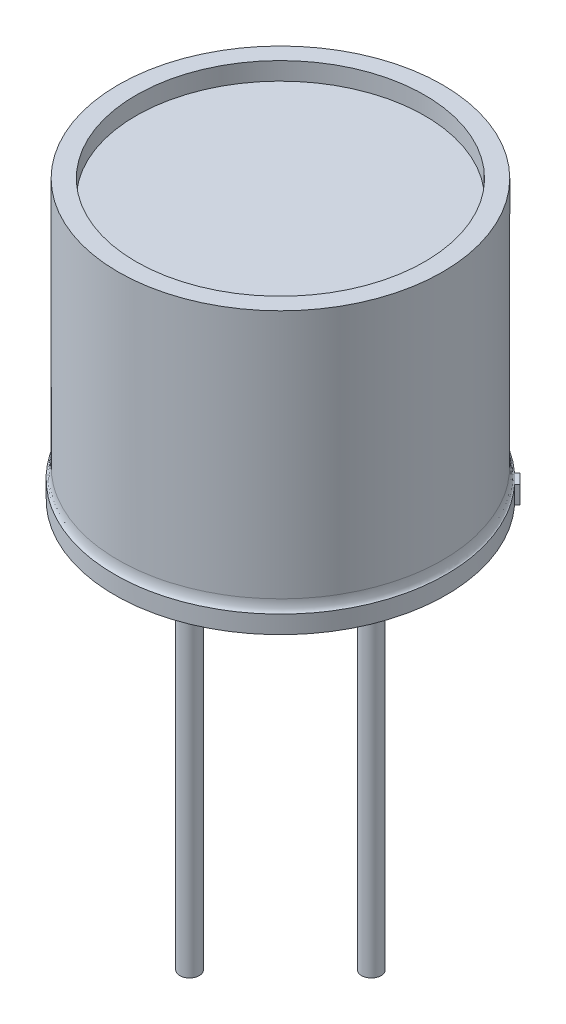
from build123d import *

# Parameters (mm, degrees)
SKETCH1_R           = 4.55
BOSS_EXTRUDE1_DEPTH = 7.8
SKETCH2_R           = 4.050000028
CUT_EXTRUDE1_DEPTH  = 0.5
SKETCH3_R           = 0.275
BOSS_EXTRUDE2_DEPTH = 10.16
SKETCH4_R           = 4.65
BOSS_EXTRUDE3_DEPTH = 0.5
FILLET1_SIZE        = 0.1
FILLET1_SIZE_2      = 0.3
BOSS_EXTRUDE4_DEPTH = 0.5


with BuildPart() as part:
    # Sketch1 → Boss-Extrude1 (new body)
    with BuildSketch(Plane(origin=(0, 0, 0), x_dir=(1, 0, 0), z_dir=(0, 1, 0))):
        with Locations(Location((0, 0, 0), (0, 0, 270))):
            Circle(SKETCH1_R)
    extrude(amount=BOSS_EXTRUDE1_DEPTH)

    # Sketch2 → Cut-Extrude1 (cut)
    with BuildSketch(Plane(origin=(0, 7.8, 0), x_dir=(1, 0, 0), z_dir=(0, 1, 0))):
        with Locations(Location((0, 0, 0), (0, 0, 270))):
            Circle(SKETCH2_R)
    extrude(amount=-CUT_EXTRUDE1_DEPTH, mode=Mode.SUBTRACT)

    # Sketch3 → Boss-Extrude2 (add)
    with BuildSketch(Plane(origin=(0, 0, 0), x_dir=(-1, 0, 0), z_dir=(0, -1, 0))):
        with Locations(Location((0, 2.55, 0), (0, 0, 270))):
            Circle(SKETCH3_R)
        with Locations(Location((2.55, 0, 0), (0, 0, 270))):
            Circle(SKETCH3_R)
        with Locations(Location((0, -2.55, 0), (0, 0, 270))):
            Circle(SKETCH3_R)
        with Locations(Location((-2.55, 0, 0), (0, 0, 270))):
            Circle(SKETCH3_R)
    extrude(amount=BOSS_EXTRUDE2_DEPTH)

    # Sketch4 → Boss-Extrude3 (add)
    with BuildSketch(Plane(origin=(0, 0, 0), x_dir=(-1, 0, 0), z_dir=(0, -1, 0))):
        with Locations(Location((0, 0, 0), (0, 0, 90))):
            Circle(SKETCH4_R)
    extrude(amount=-BOSS_EXTRUDE3_DEPTH)

    # Fillet1
    # an asymmetric fillet: 0.3, 0.1 mm, written as the material it adds along each edge
    with BuildSketch(Plane(origin=(0, 0.5, 0), x_dir=(0, 0, 1), z_dir=(1, 0, 0))) as fillet1_piece_1_section:
        with BuildLine():
            Bezier((4.55 + FILLET1_SIZE, 0), (4.55, 0), (4.55, -FILLET1_SIZE_2), weights=[1, 0.707106781, 1])
            Line((4.55, -FILLET1_SIZE_2), (4.55, 0))
            Line((4.55, 0), (4.55 + FILLET1_SIZE, 0))
        make_face()
    fillet1_piece_1 = revolve(axis=Axis((0, 0.5, 0), (0, -1, 0)), mode=Mode.PRIVATE)
    fillet1_piece_1 = fillet1_piece_1 & Plane(origin=(0, 0.585863309, 0), x_dir=(0, 0, -1), z_dir=(0, -1, 0)) * Cylinder(4.65, 19, mode=Mode.PRIVATE)
    add(fillet1_piece_1)

    # Sketch5 → Boss-Extrude4 (add)
    with BuildSketch(Plane(origin=(0, 0, 0), x_dir=(-1, 0, 0), z_dir=(0, -1, 0))):
        Polygon((-3.075914781, 3.358756928), (-3.217336137, 3.500178284), (-3.500178284, 3.217336137), (-3.358756928, 3.075914781), align=None)
    extrude(amount=-BOSS_EXTRUDE4_DEPTH)


solid = part.part
